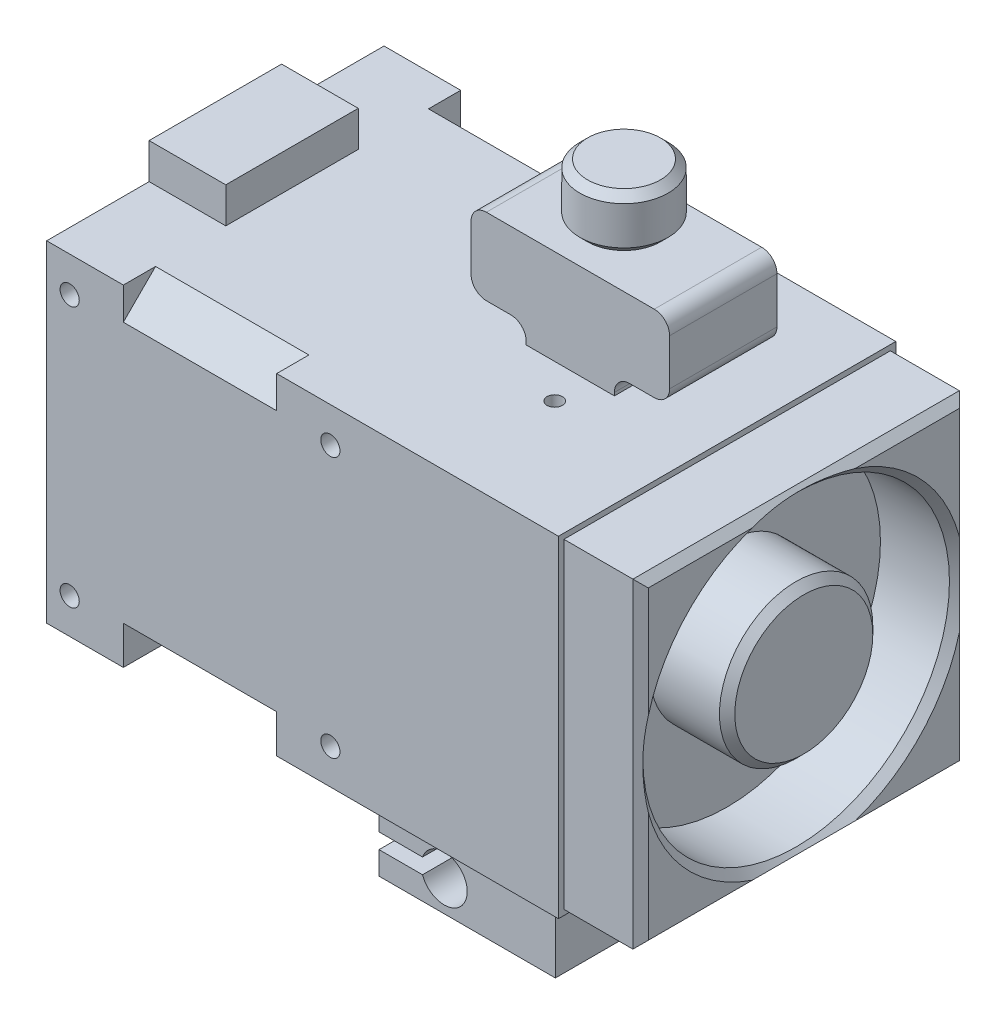
from build123d import *

# Parameters (mm, degrees)
MAIN_BLOCK_SKETCH_W            = 76.75
MAIN_BLOCK_SKETCH_H            = 43.2
MAIN_BLOCK_DEPTH               = 44
HEATER_BLOCK_DEPTH             = 8
JST_CONNECTOR_SKETCH_W         = 17.28
JST_CONNECTOR_SKETCH_H         = 4.64
JST_CONNECTOR_BLOCK_DEPTH      = 10
IDLER_BLOCK_DEPTH              = 14
MOTOR_INSET_CUTOUT_SKETCH_W    = 46
MOTOR_INSET_CUTOUT_SKETCH_H    = 46
MOTOR_INSET_DEPTH              = 20
FAN_SKETCH_R                   = 20
FAN_SKETCH_R_2                 = 10
MAIN_FAN_ROTOR_CUT_DEPTH       = 10
FAN_EDGE_CUT_SKETCH_W          = 50
FAN_EDGE_CUT_SKETCH_H          = 49.09090909
FAN_EDGE_CUT_SKETCH_W_2        = 42.57287206
FAN_EDGE_CUT_SKETCH_H_2        = 41.79881984
FAN_HOUSING_CUT_DEPTH          = 10
MOUNTING_HOLES_NEAR_SIDE_D     = 2.5
MOUNTING_HOLES_NEAR_SIDE_DEPTH = 3
MOUNTING_HOLES_NEAR_SIDE_TIP   = 0.751075774
MOUNTING_HOLES_FAR_SIDE_D      = 2.5
MOUNTING_HOLES_FAR_SIDE_DEPTH  = 3
MOUNTING_HOLES_FAR_SIDE_TIP    = 0.751075774
FILAMENT_HOLE_D                = 2
FILAMENT_HOLE_DEPTH            = 10
FILAMENT_HOLE_TIP              = 0.600860619
COSMETIC_CHAMFERS_SIZE         = 1
TENSION_ARM_FILLETS_R          = 2
NOZZLE_FILLET_R                = 0.2


with BuildPart() as part:
    # Main Block Sketch → Main Block (new body)
    with BuildSketch(Plane.XY):
        with Locations((35.375, 17)):
            Rectangle(MAIN_BLOCK_SKETCH_W, MAIN_BLOCK_SKETCH_H)
    extrude(amount=-MAIN_BLOCK_DEPTH)


with BuildPart() as body_2:
    # Nozzle +Heatbreak Sketch → Nozzle+heatbreak (revolve)
    with BuildSketch(Plane.XY.offset(-15.1), mode=Mode.PRIVATE) as nozzle_heatbreak_sk:
        Polygon((48.25, -11.7), (48.25, -23.5), (48.45, -23.5), (48.45, -24.2), (48.75, -24.2), (50.150415076, -22.2), (52.25, -22.2), (52.25, -19.2), (51.25, -19.2), (51.25, -11.7), (50.3, -11.7), (50.3, -4.6), (50.3, -3.6), (48.25, -3.6), (48.25, -4.6), align=None)
    revolve(nozzle_heatbreak_sk.sketch.rotate(Axis((48.25, 38.6, -15.1), (0, -1, 0)), 180), axis=Axis((48.25, 38.6, -15.1), (0, -1, 0)))

    # Heater Block Sketch → Heater Block (add, symmetric)
    with BuildSketch(Plane.XY.offset(-15.1)):
        with BuildLine():
            Line((38.921572875, -13.6), (33.25, -13.6))
            Line((33.25, -13.6), (33.25, -7.1))
            Line((33.25, -7.1), (56.25, -7.1))
            Line((56.25, -7.1), (56.25, -18.6))
            Line((56.25, -18.6), (33.25, -18.6))
            Line((33.25, -18.6), (33.25, -15.6))
            Line((33.25, -15.6), (38.921572875, -15.6))
            ThreePointArc((38.921572875, -15.6), (44.75, -14.6), (38.921572875, -13.6))
        make_face()
    extrude(amount=HEATER_BLOCK_DEPTH, both=True)


with BuildPart() as body_3:
    # JST Connector Sketch → JST Connector Block (new body)
    with BuildSketch(Plane(origin=(-3, 0, 0), x_dir=(0, 0, -1), z_dir=(1, 0, 0))):
        with Locations((22, 40.92)):
            Rectangle(JST_CONNECTOR_SKETCH_W, JST_CONNECTOR_SKETCH_H)
    extrude(amount=JST_CONNECTOR_BLOCK_DEPTH)


with BuildPart() as body_4:
    # Idler Block Sketch → Idler Block (new body)
    with BuildSketch(Plane.XY.offset(-19.5)):
        Polygon((40.05, 38.6), (40.05, 41), (32.85, 41), (32.85, 51), (58.75, 51), (58.75, 41), (51.55, 41), (51.55, 38.6), align=None)
    extrude(amount=-IDLER_BLOCK_DEPTH)


with BuildPart() as body_5:
    # Tension knob sketch → Tension Knob (revolve)
    with BuildSketch(Plane.XY.offset(-26.5), mode=Mode.PRIVATE) as tension_knob_sk:
        Polygon((46.8, 52), (46.8, 49), (45.8, 49), (45.8, 52), (45.8, 59), (51.55, 59), (51.55, 52), align=None)
    revolve(tension_knob_sk.sketch.rotate(Axis((45.8, 59, -26.5), (0, -1, 0)), 90), axis=Axis((45.8, 59, -26.5), (0, -1, 0)))

    # Combination of Parts: union body 4, body 3, body 2, part
    add(body_4.part)
    add(body_3.part)
    add(body_2.part)
    add(part.part)

    # Motor Inset Cutout Sketch → Motor Inset (cut)
    with BuildSketch(Plane(origin=(7, 0, 0), x_dir=(0, 0, -1), z_dir=(1, 0, 0))):
        with Locations((22, 17.4)):
            Rectangle(MOTOR_INSET_CUTOUT_SKETCH_W, MOTOR_INSET_CUTOUT_SKETCH_H)
        Polygon((5, 39.4), (39, 39.4), (44, 34.4), (44, 0.4), (39, -4.6), (5, -4.6), (0, 0.4), (0, 34.4), align=None, mode=Mode.SUBTRACT)
    extrude(amount=MOTOR_INSET_DEPTH, mode=Mode.SUBTRACT)

    # Fan Sketch → Main Fan Rotor Cut (cut)
    with BuildSketch(Plane(origin=(73.75, 0, 0), x_dir=(0, 0, -1), z_dir=(1, 0, 0))):
        with Locations((22, 17)):
            Circle(FAN_SKETCH_R)
        with Locations((22, 17)):
            Circle(FAN_SKETCH_R_2, mode=Mode.SUBTRACT)
    extrude(amount=-MAIN_FAN_ROTOR_CUT_DEPTH, mode=Mode.SUBTRACT)

    # Fan Edge Cut Sketch → Fan Housing Cut (cut)
    with BuildSketch(Plane(origin=(73.75, 0, 0), x_dir=(0, 0, -1), z_dir=(1, 0, 0))):
        with Locations((22, 17)):
            Rectangle(FAN_EDGE_CUT_SKETCH_W, FAN_EDGE_CUT_SKETCH_H)
        with Locations((22, 17)):
            Rectangle(FAN_EDGE_CUT_SKETCH_W_2, FAN_EDGE_CUT_SKETCH_H_2, mode=Mode.SUBTRACT)
    extrude(amount=-FAN_HOUSING_CUT_DEPTH, mode=Mode.SUBTRACT)

    # Mounting Holes Near Side
    with Locations(Plane.XY):
        with Locations((0, 34), (0, 0), (34, 0), (34, 34)):
            Hole(MOUNTING_HOLES_NEAR_SIDE_D / 2, depth=MOUNTING_HOLES_NEAR_SIDE_DEPTH)
            with Locations((0, 0, -(MOUNTING_HOLES_NEAR_SIDE_DEPTH + MOUNTING_HOLES_NEAR_SIDE_TIP / 2))):  # 118° drill point
                Cone(0, MOUNTING_HOLES_NEAR_SIDE_D / 2, MOUNTING_HOLES_NEAR_SIDE_TIP, mode=Mode.SUBTRACT)

    # Mounting Holes Far Side
    with Locations(Plane(origin=(0, 0, -44), x_dir=(1, 0, 0), z_dir=(0, 0, -1))):
        with Locations((0, 0), (34, 0), (34, -34), (0, -34)):
            Hole(MOUNTING_HOLES_FAR_SIDE_D / 2, depth=MOUNTING_HOLES_FAR_SIDE_DEPTH)
            with Locations((0, 0, -(MOUNTING_HOLES_FAR_SIDE_DEPTH + MOUNTING_HOLES_FAR_SIDE_TIP / 2))):  # 118° drill point
                Cone(0, MOUNTING_HOLES_FAR_SIDE_D / 2, MOUNTING_HOLES_FAR_SIDE_TIP, mode=Mode.SUBTRACT)

    # Filament Hole
    with Locations(Plane(origin=(0, 38.6, 0), x_dir=(1, 0, 0), z_dir=(0, 1, 0))):
        with Locations((48.228258832, 15.029737369)):
            Hole(FILAMENT_HOLE_D / 2, depth=FILAMENT_HOLE_DEPTH)
            with Locations((0, 0, -(FILAMENT_HOLE_DEPTH + FILAMENT_HOLE_TIP / 2))):  # 118° drill point
                Cone(0, FILAMENT_HOLE_D / 2, FILAMENT_HOLE_TIP, mode=Mode.SUBTRACT)

    # Cosmetic Chamfers
    # the kernel refuses this chamfer: 1 mm, written as the material it adds along each edge
    with BuildSketch(Plane(origin=(48.25, -4.6, -15.1), x_dir=(-1, 0, 0), z_dir=(0, 0, -1))) as cosmetic_chamfers_piece_1:
        Polygon((2.05 + COSMETIC_CHAMFERS_SIZE, 0), (2.05, -COSMETIC_CHAMFERS_SIZE), (2.05, 0), align=None)
    revolve(axis=Axis((48.25, -4.6, -15.1), (0, 1, 0)))
    # the kernel refuses this chamfer: 1 mm, written as the material it takes off along each edge
    with BuildSketch(Plane(origin=(73.75, 17, -22), x_dir=(0, 0, -1), z_dir=(0, -1, 0))) as cosmetic_chamfers_2_piece_1:
        Polygon((20 + COSMETIC_CHAMFERS_SIZE, 0), (20, -COSMETIC_CHAMFERS_SIZE), (20, 0), align=None)
    revolve(axis=Axis((73.75, 17, -22), (1, 0, 0)), mode=Mode.SUBTRACT)
    with BuildSketch(Plane(origin=(73.75, 17, -22), x_dir=(0, 0, -1), z_dir=(0, -1, 0))) as cosmetic_chamfers_2_piece_2:
        Polygon((10, -COSMETIC_CHAMFERS_SIZE), (10 - COSMETIC_CHAMFERS_SIZE, 0), (10, 0), align=None)
    revolve(axis=Axis((73.75, 17, -22), (1, 0, 0)), mode=Mode.SUBTRACT)
    with BuildSketch(Plane(origin=(73.75, 37.89940992, 1.858119018), x_dir=(-0.9996219169112968, 0.027495876610589196, 0), z_dir=(0, 0, -1)), Plane(origin=(73.75, -3.89940992, -45.858119018), x_dir=(-0.9996219169112968, -0.027495876610586605, 0), z_dir=(0, 0, 1))) as cosmetic_chamfers_2_piece_3:
        Polygon((COSMETIC_CHAMFERS_SIZE * 0.999621916911, -COSMETIC_CHAMFERS_SIZE * 0.0274958766106), (-COSMETIC_CHAMFERS_SIZE * 0.0274958766106, -COSMETIC_CHAMFERS_SIZE * 0.999621916911), (0, 0), align=None)
    extrude(amount=47.716238035, mode=Mode.SUBTRACT)
    with BuildSketch(Plane(origin=(73.75, -6.471092908, -0.71356397), x_dir=(-0.9996219169112968, 0, 0.027495876610586497), z_dir=(0, 1, 0)), Plane(origin=(73.75, 40.471092908, -43.28643603), x_dir=(-0.9996219169112968, 0, -0.027495876610589196), z_dir=(0, -1, 0))) as cosmetic_chamfers_2_piece_4:
        Polygon((COSMETIC_CHAMFERS_SIZE * 0.999621916911, -COSMETIC_CHAMFERS_SIZE * 0.0274958766106), (-COSMETIC_CHAMFERS_SIZE * 0.0274958766106, -COSMETIC_CHAMFERS_SIZE * 0.999621916911), (0, 0), align=None)
    extrude(amount=46.942185816, mode=Mode.SUBTRACT)
    with BuildSketch(Plane(origin=(45.8, 52, -26.5), x_dir=(0, 0, 1), z_dir=(1, 0, 0))) as cosmetic_chamfers_2_piece_5:
        Polygon((5.75 - COSMETIC_CHAMFERS_SIZE, 0), (5.75, -COSMETIC_CHAMFERS_SIZE), (5.75, 0), align=None)
    revolve(axis=Axis((45.8, 52, -26.5), (0, -1, 0)), mode=Mode.SUBTRACT)
    with BuildSketch(Plane(origin=(45.8, 59, -26.5), x_dir=(0, 0, 1), z_dir=(1, 0, 0))) as cosmetic_chamfers_2_piece_6:
        Polygon((5.75, COSMETIC_CHAMFERS_SIZE), (5.75 - COSMETIC_CHAMFERS_SIZE, 0), (5.75, 0), align=None)
    revolve(axis=Axis((45.8, 59, -26.5), (0, -1, 0)), mode=Mode.SUBTRACT)

    # Tension Arm Fillets
    tension_arm_fillets_edges = [body_5.edges().sort_by_distance(p)[0] for p in [
        (40.05, 41, -26.5),
        (32.85, 41, -26.5),
        (32.85, 51, -26.5),
        (58.75, 51, -26.5),
        (58.75, 41, -26.5),
        (51.55, 41, -26.5),
    ]]
    fillet(tension_arm_fillets_edges, radius=TENSION_ARM_FILLETS_R)

    # Nozzle Fillet
    nozzle_fillet_edges = [body_5.edges().sort_by_distance(p)[0] for p in [
        (48.75, -24.2, -15.1),
    ]]
    fillet(nozzle_fillet_edges, radius=NOZZLE_FILLET_R)


solid = body_5.part
